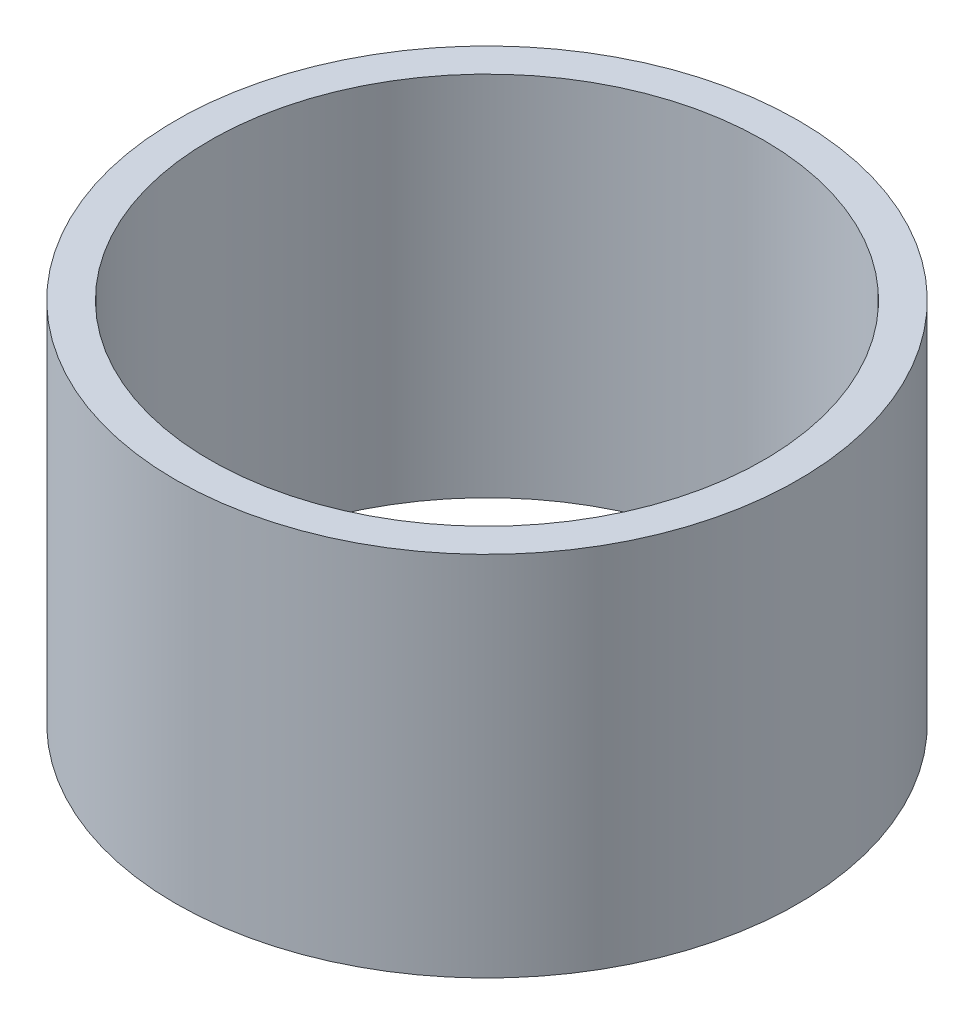
from build123d import *

# Parameters (mm, degrees)
SKETCH1_R           = 50
BOSS_EXTRUDE1_DEPTH = 58.922171109
SKETCH2_R           = 44.468869073
CUT_EXTRUDE1_DEPTH  = 93.042502401


with BuildPart() as part:
    # Sketch1 → Boss-Extrude1 (new body)
    with BuildSketch(Plane(origin=(0, 0, 0), x_dir=(1, 0, 0), z_dir=(0, 1, 0))):
        Circle(SKETCH1_R)
    extrude(amount=BOSS_EXTRUDE1_DEPTH)

    # Sketch2 → Cut-Extrude1 (cut, through all)
    with BuildSketch(Plane(origin=(0, 0, 0), x_dir=(1, 0, 0), z_dir=(0, 1, 0))):
        Circle(SKETCH2_R)
    extrude(amount=CUT_EXTRUDE1_DEPTH, mode=Mode.SUBTRACT)


solid = part.part
